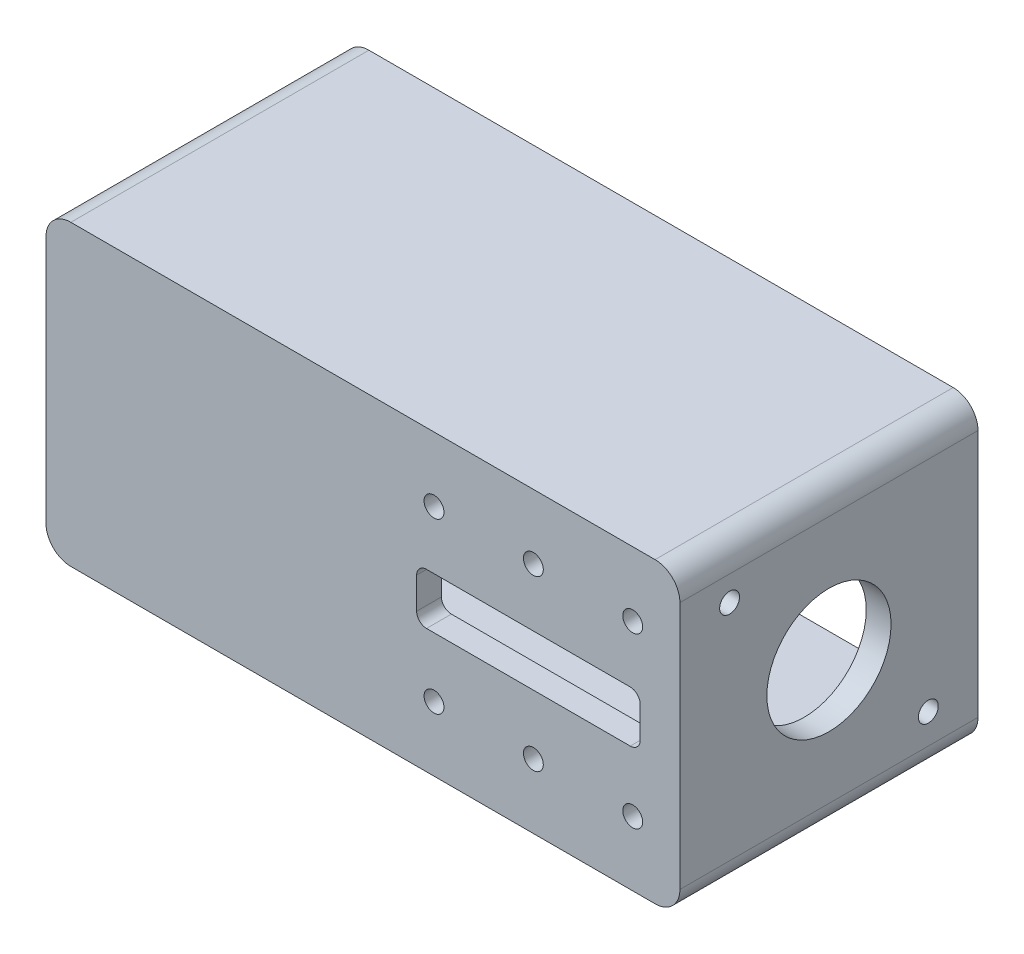
from build123d import *

# Parameters (mm, degrees)
BOSS_EXTRUDE1_DEPTH  = 60
SKETCH3_R            = 2
CUT_EXTRUDE2_DEPTH   = 35
SKETCH2_W            = 117.6
SKETCH2_H            = 50
CUT_EXTRUDE4_DEPTH   = 55
BOSS_EXTRUDE2_DEPTH  = 50
SKETCH8_R            = 12.7
CUT_EXTRUDE5_DEPTH   = 35
SKETCH13_R           = 2
CUT_EXTRUDE6_DEPTH   = 145.190091546
SKETCH14_R           = 1.5
CUT_EXTRUDE7_DEPTH   = 10
SKETCH16_R           = 12.5
CUT_EXTRUDE8_DEPTH   = 10
SKETCH17_R           = 1.5
CUT_EXTRUDE9_DEPTH   = 20
SKETCH18_R           = 1.5
CUT_EXTRUDE10_DEPTH  = 20
LPATTERN1_COUNT      = 4
LPATTERN1_PITCH      = 35
LPATTERN1_COUNT_DIR2 = 2
LPATTERN1_PITCH_DIR2 = 55
FILLET1_R            = 10


with BuildPart() as part:
    # Sketch1 → Boss-Extrude1 (new body)
    with BuildSketch(Plane.XY):
        with BuildLine():
            Line((-58.8, -30.15), (58.8, -30.15))
            ThreePointArc((58.8, -30.15), (62.335533906, -28.685533906), (63.8, -25.15))
            Line((63.8, -25.15), (63.8, 24.85))
            ThreePointArc((63.8, 24.85), (62.335533906, 28.385533906), (58.8, 29.85))
            Line((58.8, 29.85), (-58.8, 29.85))
            ThreePointArc((-58.8, 29.85), (-62.335533906, 28.385533906), (-63.8, 24.85))
            Line((-63.8, 24.85), (-63.8, -25.15))
            ThreePointArc((-63.8, -25.15), (-62.335533906, -28.685533906), (-58.8, -30.15))
        make_face()
        with BuildLine():
            Line((53.8, 5.15), (12.8, 5.15))
            ThreePointArc((12.8, 5.15), (11.385786438, 4.564213562), (10.8, 3.15))
            Line((10.8, 3.15), (10.8, -3.15))
            ThreePointArc((10.8, -3.15), (11.385786438, -4.564213562), (12.8, -5.15))
            Line((12.8, -5.15), (53.8, -5.15))
            ThreePointArc((53.8, -5.15), (55.214213562, -4.564213562), (55.8, -3.15))
            Line((55.8, -3.15), (55.8, 3.15))
            ThreePointArc((55.8, 3.15), (55.214213562, 4.564213562), (53.8, 5.15))
        make_face(mode=Mode.SUBTRACT)
    extrude(amount=BOSS_EXTRUDE1_DEPTH)

    # Sketch3 → Cut-Extrude2 (cut)
    with BuildSketch(Plane.XY.offset(60)):
        with Locations((14.3, 16.85)):
            Circle(SKETCH3_R)
        with Locations((34.3, 16.85)):
            Circle(SKETCH3_R)
        with Locations((54.3, 16.85)):
            Circle(SKETCH3_R)
        with Locations((34.3, -17.15)):
            Circle(SKETCH3_R)
        with Locations((54.3, -17.15)):
            Circle(SKETCH3_R)
        with Locations((14.3, -17.15)):
            Circle(SKETCH3_R)
    extrude(amount=-CUT_EXTRUDE2_DEPTH, mode=Mode.SUBTRACT)

    # Sketch2 → Cut-Extrude4 (cut)
    with BuildSketch(Plane(origin=(0, 0, 0), x_dir=(-1, 0, 0), z_dir=(0, 0, -1))):
        with Locations((0, -0.15)):
            Rectangle(SKETCH2_W, SKETCH2_H)
    extrude(amount=-CUT_EXTRUDE4_DEPTH, mode=Mode.SUBTRACT)

    # Sketch12 → Boss-Extrude2 (add)
    with BuildSketch(Plane(origin=(0, 0, 55), x_dir=(-1, 0, 0), z_dir=(0, 0, -1))):
        Polygon((53.8, 24.85), (38.80387838, 24.85), (38.80387838, -25.15), (58.8, -25.15), (58.8, 19.85), (58.8, 24.85), align=None)
    extrude(amount=BOSS_EXTRUDE2_DEPTH)

    # Sketch8 → Cut-Extrude5 (cut)
    with BuildSketch(Plane.ZY.offset(63.8)):
        with Locations(Location((30, -0.15, 0), (0, 0, 270))):
            Circle(SKETCH8_R)
    extrude(amount=-CUT_EXTRUDE5_DEPTH, mode=Mode.SUBTRACT)

    # Sketch13 → Cut-Extrude6 (cut, through all)
    with BuildSketch(Plane.ZY.offset(63.8)):
        with Locations((10, -19.15)):
            Circle(SKETCH13_R)
        with Locations((50, 19.85)):
            Circle(SKETCH13_R)
    extrude(amount=-CUT_EXTRUDE6_DEPTH, mode=Mode.SUBTRACT)

    # Sketch14 → Cut-Extrude7 (cut)
    with BuildSketch(Plane(origin=(0, 0, 5), x_dir=(-1, 0, 0), z_dir=(0, 0, -1))):
        with Locations((52.64387838, -0.15)):
            Circle(SKETCH14_R)
        with Locations((42.04387838, 15.05)):
            Circle(SKETCH14_R)
        with Locations((42.04387838, -15.35)):
            Circle(SKETCH14_R)
    extrude(amount=-CUT_EXTRUDE7_DEPTH, mode=Mode.SUBTRACT)

    # Sketch16 → Cut-Extrude8 (cut)
    with BuildSketch(Plane(origin=(56.19612162, 0, 0), x_dir=(0, 0, -1), z_dir=(1, 0, 0))):
        with Locations((-30, -0.15)):
            Circle(SKETCH16_R)
    extrude(amount=CUT_EXTRUDE8_DEPTH, mode=Mode.SUBTRACT)

    # Sketch17 → Cut-Extrude9 (cut)
    with BuildSketch(Plane(origin=(0, 0, 0), x_dir=(-1, 0, 0), z_dir=(0, 0, -1))):
        with Locations((-53.8, 27.35)):
            Circle(SKETCH17_R)
    cut_extrude9 = extrude(amount=-CUT_EXTRUDE9_DEPTH, mode=Mode.SUBTRACT)

    # Sketch18 → Cut-Extrude10 (cut)
    with BuildSketch(Plane(origin=(0, 0, 0), x_dir=(-1, 0, 0), z_dir=(0, 0, -1))):
        with Locations((-61.3, 9.85)):
            Circle(SKETCH18_R)
        with Locations((-61.3, -10.15)):
            Circle(SKETCH18_R)
    cut_extrude10 = extrude(amount=-CUT_EXTRUDE10_DEPTH, mode=Mode.SUBTRACT)

    # LPattern1: Cut-Extrude9 4 × 2
    with Locations(*[(-i * LPATTERN1_PITCH, -j * LPATTERN1_PITCH_DIR2, 0) for i in range(LPATTERN1_COUNT) for j in range(LPATTERN1_COUNT_DIR2) if (i, j) != (0, 0)]):
        add(cut_extrude9, mode=Mode.SUBTRACT)

    # Mirror1: Cut-Extrude10 across plane
    add(cut_extrude10.mirror(Plane(origin=(0, 0, 0), x_dir=(0, 0, 1), z_dir=(1, 0, 0))), mode=Mode.SUBTRACT)

    # Fillet1
    # the kernel refuses this fillet: 10 mm, written as the material it adds along each edge
    with BuildSketch(Plane(origin=(-38.80387838, 24.85, 55), x_dir=(1, 0, 0), z_dir=(0, 0, -1))) as fillet1_piece_1_section:
        with BuildLine():
            CenterArc((FILLET1_R, FILLET1_R), FILLET1_R, 180, 90)
            Line((0, FILLET1_R), (0, 0))
            Line((0, 0), (FILLET1_R, 0))
        make_face()
    fillet1_piece_1 = extrude(amount=50, mode=Mode.PRIVATE)
    fillet1_piece_1 = fillet1_piece_1 - Plane(origin=(-36.514873335, 19.85, 50), x_dir=(0, 0, 1), z_dir=(-1, 0, 0)) * Cylinder(2, 140, mode=Mode.PRIVATE)
    add(fillet1_piece_1)
    with BuildSketch(Plane(origin=(-38.80387838, -25.15, 55), x_dir=(1, 0, 0), z_dir=(0, 0, -1))) as fillet1_piece_2_section:
        with BuildLine():
            CenterArc((FILLET1_R, -FILLET1_R), FILLET1_R, 90, 90)
            Line((0, -FILLET1_R), (0, 0))
            Line((0, 0), (FILLET1_R, 0))
        make_face()
    fillet1_piece_2 = extrude(amount=50, mode=Mode.PRIVATE)
    fillet1_piece_2 = fillet1_piece_2 - Plane(origin=(-36.519941054, -19.15, 10), x_dir=(0, 0, 1), z_dir=(-1, 0, 0)) * Cylinder(2, 140, mode=Mode.PRIVATE)
    add(fillet1_piece_2)
    with BuildSketch(Plane(origin=(58.8, 24.85, 0), x_dir=(-1, 0, 0), z_dir=(0, 0, 1))) as fillet1_piece_3_section:
        with BuildLine():
            CenterArc((FILLET1_R, FILLET1_R), FILLET1_R, 180, 90)
            Line((0, FILLET1_R), (0, 0))
            Line((0, 0), (FILLET1_R, 0))
        make_face()
    fillet1_piece_3 = extrude(amount=55, mode=Mode.PRIVATE)
    fillet1_piece_3 = fillet1_piece_3 - Plane(origin=(56.513305824, 19.85, 50), x_dir=(0, 0, 1), z_dir=(-1, 0, 0)) * Cylinder(2, 150, mode=Mode.PRIVATE)
    add(fillet1_piece_3)
    with BuildSketch(Plane(origin=(58.8, -25.15, 0), x_dir=(0, 1, 0), z_dir=(0, 0, 1))) as fillet1_piece_4_section:
        with BuildLine():
            CenterArc((FILLET1_R, FILLET1_R), FILLET1_R, 180, 90)
            Line((0, FILLET1_R), (0, 0))
            Line((0, 0), (FILLET1_R, 0))
        make_face()
    fillet1_piece_4 = extrude(amount=55, mode=Mode.PRIVATE)
    fillet1_piece_4 = fillet1_piece_4 - Plane(origin=(56.517896766, -19.15, 10), x_dir=(0, 0, 1), z_dir=(-1, 0, 0)) * Cylinder(2, 150, mode=Mode.PRIVATE)
    add(fillet1_piece_4)


solid = part.part
